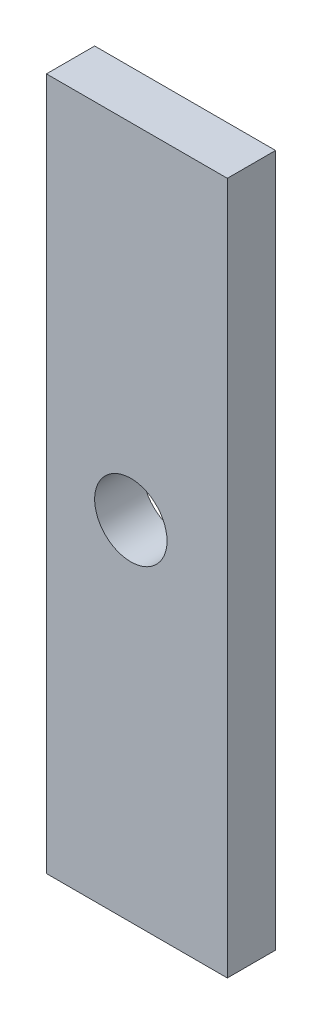
from build123d import *

# Parameters (mm, degrees)
SKETCH1_W           = 7.5
SKETCH1_H           = 28.712969094
SKETCH1_R           = 1.5
BOSS_EXTRUDE1_DEPTH = 2


with BuildPart() as part:
    # Sketch1 → Boss-Extrude1 (new body)
    with BuildSketch(Plane.XY):
        with Locations((0.25, -0.084515453)):
            Rectangle(SKETCH1_W, SKETCH1_H)
        Circle(SKETCH1_R, mode=Mode.SUBTRACT)
    extrude(amount=BOSS_EXTRUDE1_DEPTH)


solid = part.part
